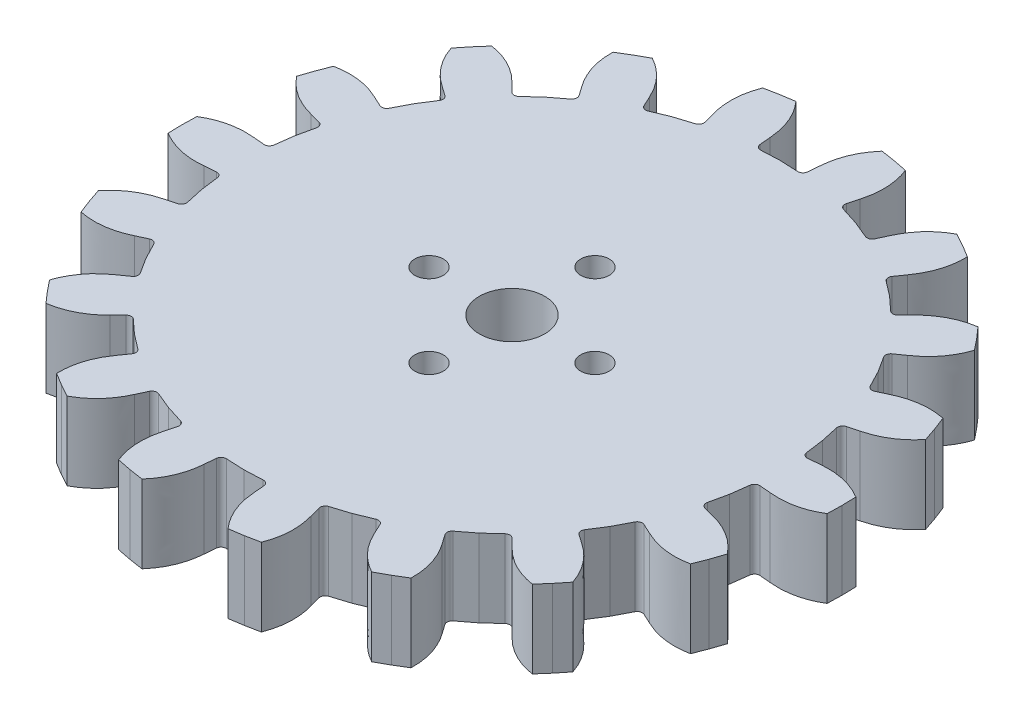
from build123d import *

# Parameters (mm, degrees)
BOSS_EXTRUDE1_DEPTH      = 7.5
FILLET1_R                = 0.5
CIRPATTERN1_COUNT        = 18
FILLET1_OF_CIRPATTERN1_R = 0.5
SKETCH3_R                = 3.15
SKETCH3_R_2              = 1.375
CUT_EXTRUDE1_DEPTH       = 46.403760092


with BuildPart() as part:
    # Sketch2 → Boss-Extrude1 (new body)
    with BuildSketch(Plane(origin=(0, 0, 0), x_dir=(1, 0, 0), z_dir=(0, 1, 0))):
        with BuildLine():
            Line((-25.739180512, 2.251886503), (-27.285772781, 2.387195794))
            add(Edge.make_bspline(
                [(-27.285772781, 2.387195794), (-29.733321363, 2.631764933), (-31.769733446, 1.387096518)],
                knots=[0, 0, 0, 1, 1, 1], degree=2))
            Line((-31.769733446, 1.387096518), (-31.8, 0))
            Line((-31.8, 0), (-31.769733446, -1.387096518))
            add(Edge.make_bspline(
                [(-27.285772781, -2.387195794), (-29.733321363, -2.631764933), (-31.769733446, -1.387096518)],
                knots=[0, 0, 0, 1, 1, 1], degree=2))
            Line((-27.285772781, -2.387195794), (-25.739180512, -2.251886503))
            Line((-25.739180512, -2.251886503), (-25.444970318, -4.48663479))
            Line((-25.444970318, -4.48663479), (0, 0))
            Line((0, 0), (-25.444970318, 4.48663479))
            Line((-25.444970318, 4.48663479), (-25.739180512, 2.251886503))
        make_face()
    boss_extrude1 = extrude(amount=BOSS_EXTRUDE1_DEPTH)

    # Fillet1
    fillet1_edges = [part.edges().sort_by_distance(p)[0] for p in [
        (-25.739180512, 3.75, -2.251886503),
        (-25.739180512, 3.75, 2.251886503),
    ]]
    fillet(fillet1_edges, radius=FILLET1_R)

    # CirPattern1: Boss-Extrude1 ×18 about axis
    cirpattern1_axis = Axis((0, 7.5, 0), (0, -1, 0))
    for i in range(1, CIRPATTERN1_COUNT):
        add(boss_extrude1.rotate(cirpattern1_axis, i * 360 / CIRPATTERN1_COUNT))

    # Fillet1 of CirPattern1
    fillet1_of_cirpattern1_edges = [part.edges().sort_by_distance(p)[0] for p in [
        (-23.416727448, 3.75, -10.919399338),
        (-24.957108537, 3.75, -6.687237078),
        (-18.269871459, 3.75, -18.269871459),
        (-21.164840944, 3.75, -14.819781174),
        (-10.919399338, 3.75, -23.416727448),
        (-14.819781174, 3.75, -21.164840944),
        (-2.251886503, 3.75, -25.739180512),
        (-6.687237078, 3.75, -24.957108537),
        (6.687237078, 3.75, -24.957108537),
        (2.251886503, 3.75, -25.739180512),
        (14.819781174, 3.75, -21.164840944),
        (10.919399338, 3.75, -23.416727448),
        (21.164840944, 3.75, -14.819781174),
        (18.269871459, 3.75, -18.269871459),
        (24.957108537, 3.75, -6.687237078),
        (23.416727448, 3.75, -10.919399338),
        (25.739180512, 3.75, 2.251886503),
        (25.739180512, 3.75, -2.251886503),
        (23.416727448, 3.75, 10.919399338),
        (24.957108537, 3.75, 6.687237078),
        (18.269871459, 3.75, 18.269871459),
        (21.164840944, 3.75, 14.819781174),
        (10.919399338, 3.75, 23.416727448),
        (14.819781174, 3.75, 21.164840944),
        (2.251886503, 3.75, 25.739180512),
        (6.687237078, 3.75, 24.957108537),
        (-6.687237078, 3.75, 24.957108537),
        (-2.251886503, 3.75, 25.739180512),
        (-14.819781174, 3.75, 21.164840944),
        (-10.919399338, 3.75, 23.416727448),
        (-21.164840944, 3.75, 14.819781174),
        (-18.269871459, 3.75, 18.269871459),
        (-24.957108537, 3.75, 6.687237078),
        (-23.416727448, 3.75, 10.919399338),
    ]]
    fillet(fillet1_of_cirpattern1_edges, radius=FILLET1_OF_CIRPATTERN1_R)

    # Sketch3 → Cut-Extrude1 (cut, through all)
    with BuildSketch(Plane(origin=(0, 7.5, 0), x_dir=(1, 0, 0), z_dir=(0, 1, 0))):
        Circle(SKETCH3_R)
        with Locations((-8, 0)):
            Circle(SKETCH3_R_2)
        with Locations((0, 8)):
            Circle(SKETCH3_R_2)
        with Locations((8, 0)):
            Circle(SKETCH3_R_2)
        with Locations((0, -8)):
            Circle(SKETCH3_R_2)
    extrude(amount=-CUT_EXTRUDE1_DEPTH, mode=Mode.SUBTRACT)


solid = part.part
